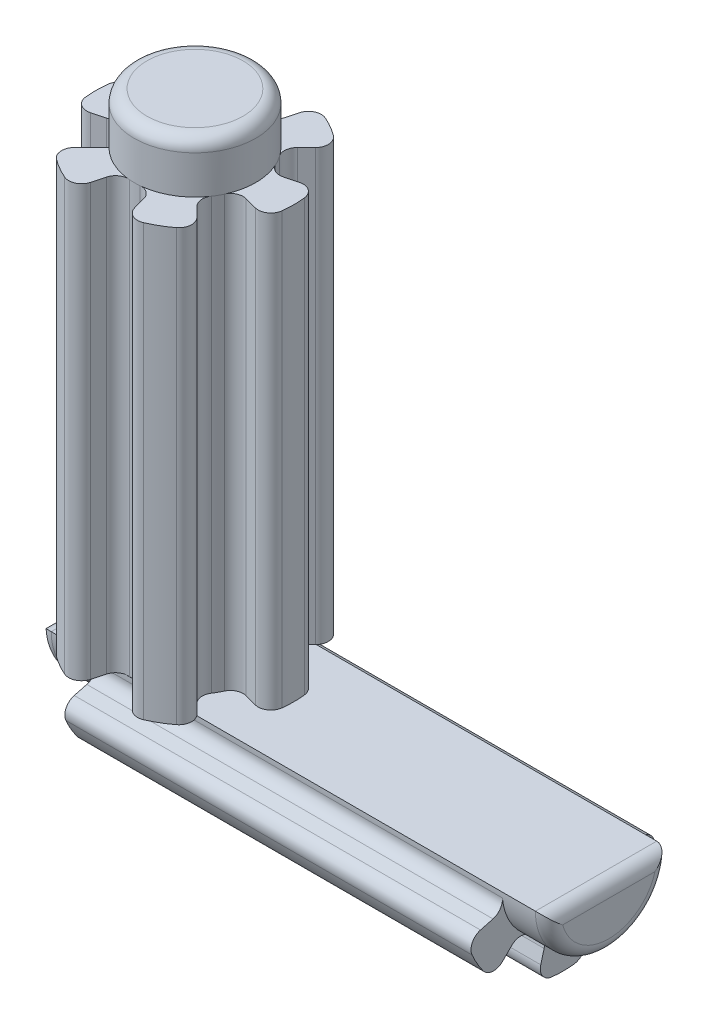
from build123d import *

# Parameters (mm, degrees)
BOSS_EXTRUDE1_DEPTH  = 16.85
SKETCH2_R            = 2.3799999999999994
BOSS_EXTRUDE2_DEPTH  = 2
BOSS_EXTRUDE9_START  = 2.3
BOSS_EXTRUDE9_DEPTH  = 19.95
BOSS_EXTRUDE10_START = 0.5
BOSS_EXTRUDE10_DEPTH = 15.9
FILLET2_3_DEPTH      = 16.85
FILLET2_START        = -1.5
FILLET2_4_DEPTH      = 15.9
FILLET2_5_DEPTH      = 16.85
FILLET2_START_2      = -3
FILLET2_6_DEPTH      = 6
FILLET2_7_DEPTH      = 15.9
FILLET3_R            = 0.5


with BuildPart() as part:
    # Sketch1 → Boss-Extrude1 (new body)
    with BuildSketch(Plane(origin=(0, 0, 0), x_dir=(1, 0, 0), z_dir=(0, 1, 0))):
        with BuildLine():
            Line((-2.7400387770978836, 2.74003877709786), (-1.679378605318062, 1.6793786053180386))
            ThreePointArc((-1.679378605318062, 1.6793786053180386), (-2.056810333988042, 1.1874999999999993), (-2.2940738374365335, 0.6146952321185013))
            Line((-2.2940738374365335, 0.6146952321185011), (-3.7429625768701356, 1.0029237997722829))
            ThreePointArc((-3.742962576870136, 1.0029237997722822), (-3.875, 1.424e-14), (-3.7429625768701427, -1.0029237997722564))
            Line((-3.742962576870142, -1.002923799772257), (-2.2940738374365406, -0.6146952321184749))
            ThreePointArc((-2.2940738374365406, -0.614695232118475), (-2.0568103339880466, -1.1874999999999907), (-1.6793786053180566, -1.6793786053180437))
            Line((-1.6793786053180566, -1.6793786053180435), (-2.740038777097876, -2.740038777097867))
            ThreePointArc((-2.740038777097877, -2.7400387770978663), (-1.9375000000000047, -3.355848439664697), (-1.0029237997722709, -3.7429625768701387))
            Line((-1.0029237997722698, -3.7429625768701387), (-0.6146952321184938, -2.2940738374365353))
            ThreePointArc((-0.6146952321184939, -2.2940738374365357), (-2.66e-15, -2.3750000000000004), (0.614695232118489, -2.2940738374365375))
            Line((0.6146952321184889, -2.294073837436537), (1.0029237997722713, -3.742962576870139))
            ThreePointArc((1.0029237997722693, -3.742962576870139), (1.9607957049122844, -3.34229041281537), (2.777890980129203, -2.7016562887452613))
            Line((2.7778909801292047, -2.7016562887452595), (1.7174212075554607, -1.6404540212510508))
            ThreePointArc((1.7174212075554605, -1.6404540212510508), (2.0702822023505663, -1.1638542016208417), (2.294073837436537, -0.6146952321184882))
            Line((2.294073837436537, -0.6146952321184883), (3.742962576870139, -1.0029237997722702))
            ThreePointArc((3.7429625768701387, -1.002923799772271), (3.8418488378235147, -0.5057889948527037), (3.875, -9.5e-16))
            ThreePointArc((3.875, 0), (3.8418488378235156, 0.5057889948526962), (3.7429625768701413, 1.0029237997722609))
            Line((3.7429625768701413, 1.002923799772261), (2.2940738374365384, 0.6146952321184828))
            ThreePointArc((2.2940738374365384, 0.6146952321184829), (2.0568103339880426, 1.1874999999999978), (1.6793786053180506, 1.67937860531805))
            Line((1.6793786053180506, 1.6793786053180497), (2.740038777097872, 2.740038777097871))
            ThreePointArc((2.7400387770978725, 2.740038777097871), (1.937499999999998, 3.355848439664701), (1.0029237997722638, 3.7429625768701404))
            Line((1.0029237997722638, 3.7429625768701404), (0.6146952321184845, 2.294073837436538))
            ThreePointArc((0.6146952321184845, 2.294073837436538), (-5.91e-15, 2.375), (-0.6146952321184961, 2.294073837436535))
            Line((-0.614695232118496, 2.294073837436535), (-1.0029237997722746, 3.7429625768701373))
            ThreePointArc((-1.0029237997722749, 3.742962576870138), (-1.9375000000000095, 3.355848439664694), (-2.7400387770978836, 2.7400387770978596))
        make_face()
    extrude(amount=BOSS_EXTRUDE1_DEPTH)

    # Sketch2 → Boss-Extrude2 (add)
    with BuildSketch(Plane(origin=(0, 16.85, 0), x_dir=(1, 0, 0), z_dir=(0, 1, 0))):
        with Locations(Location((0, 0, 0), (0, 0, 75))):
            Circle(SKETCH2_R)
    extrude(amount=BOSS_EXTRUDE2_DEPTH)

    # Sketch10 → Boss-Extrude9 (add)
    with BuildSketch(Plane(origin=(13.899999999999999, 0, 0), x_dir=(0, 0, -1), z_dir=(1, 0, 0)).offset(BOSS_EXTRUDE9_START)):
        with BuildLine():
            Line((2.375, 0), (-2.375, 0))
            ThreePointArc((-2.375, 0), (-2.3546815457628005, -0.30999970652261516), (-2.2940738374365415, -0.6146952321184724))
            ThreePointArc((-2.294073837436541, -0.6146952321184722), (-2.0568103339880484, -1.1874999999999882), (-1.679378605318059, -1.6793786053180417))
            ThreePointArc((-1.6793786053180593, -1.6793786053180415), (-1.1875000000000056, -2.0568103339880377), (-0.614695232118488, -2.294073837436537))
            ThreePointArc((-0.6146952321184879, -2.294073837436537), (8e-16, -2.375), (0.6146952321184889, -2.2940738374365366))
            ThreePointArc((0.6146952321184891, -2.2940738374365366), (1.1874999999999993, -2.0568103339880426), (1.6793786053180475, -1.679378605318053))
            ThreePointArc((1.679378605318047, -1.6793786053180533), (2.0568103339880404, -1.1875000000000027), (2.2940738374365366, -0.6146952321184884))
            ThreePointArc((2.294073837436536, -0.6146952321184882), (2.3546815457627996, -0.30999970652262326), (2.374999999999999, 1.5e-16))
        make_face()
    extrude(amount=-BOSS_EXTRUDE9_DEPTH)

    # Sketch10<3> → Boss-Extrude10 (add)
    with BuildSketch(Plane(origin=(13.899999999999999, 0, 0), x_dir=(0, 0, -1), z_dir=(1, 0, 0)).offset(BOSS_EXTRUDE10_START)):
        with BuildLine():
            Line((3.742962576870139, -1.0029237997722704), (2.2940738374365366, -0.6146952321184883))
            ThreePointArc((2.2940738374365366, -0.6146952321184884), (2.0568103339880404, -1.1875000000000027), (1.679378605318047, -1.6793786053180533))
            Line((1.6793786053180473, -1.6793786053180535), (2.740038777097866, -2.740038777097877))
            ThreePointArc((2.740038777097866, -2.7400387770978774), (3.3558484396646966, -1.937500000000004), (3.7429625768701396, -1.0029237997722706))
        make_face()
        with BuildLine():
            ThreePointArc((0.6146952321184889, -2.2940738374365366), (8e-16, -2.375), (-0.6146952321184879, -2.294073837436537))
            Line((-0.6146952321184881, -2.294073837436537), (-1.00292379977227, -3.7429625768701387))
            ThreePointArc((-1.0029237997722702, -3.7429625768701396), (9.4e-16, -3.874999999999999), (1.0029237997722722, -3.7429625768701387))
            Line((1.0029237997722715, -3.7429625768701382), (0.614695232118489, -2.2940738374365366))
        make_face()
        with BuildLine():
            ThreePointArc((-1.679378605318059, -1.6793786053180417), (-2.0568103339880484, -1.1874999999999882), (-2.294073837436541, -0.6146952321184722))
            Line((-2.294073837436541, -0.6146952321184723), (-3.7429625768701458, -1.002923799772244))
            ThreePointArc((-3.7429625768701453, -1.002923799772244), (-3.3558484396647104, -1.937499999999981), (-2.7400387770978853, -2.740038777097858))
            Line((-2.740038777097886, -2.740038777097858), (-1.6793786053180595, -1.6793786053180415))
        make_face()
    extrude(amount=-BOSS_EXTRUDE10_DEPTH)

    # Fillet2: read off the stored shape, not the designer's step
    # Fillet2 outline → Fillet2 (revolve, cut)
    with BuildSketch(Plane.XY):
        with BuildLine():
            ThreePointArc((1.88, 18.85), (2.233553391, 18.703553391), (2.38, 18.35))
            Line((2.38, 18.35), (2.38, 18.85))
            Line((2.38, 18.85), (1.88, 18.85))
        make_face()
    revolve(axis=Axis((0, 0, 0), (0, 1, 0)), mode=Mode.SUBTRACT)

    # Fillet2 2 outline → Fillet2 2 (revolve, cut)
    with BuildSketch(Plane.YX):
        with BuildLine():
            ThreePointArc((1.875, 16.2), (2.228553391, 16.053553391), (2.375, 15.7))
            Line((2.375, 15.7), (2.375, 16.2))
            Line((2.375, 16.2), (1.875, 16.2))
        make_face()
    revolve(axis=Axis((0, 0, 0), (1, 0, 0)), mode=Mode.SUBTRACT)

    # Fillet2 3 outline → Fillet2 3 (add)
    with BuildSketch(Plane(origin=(0, 0, 0), x_dir=(1, 0, 0), z_dir=(0, 1, 0))):
        with BuildLine():
            Line((-0.614695232, -2.294073837), (-0.732765352, -2.734717524))
            ThreePointArc((-0.732765352, -2.734717524), (-0.536645734, -2.454589596), (-0.206358537, -2.366017995))
            ThreePointArc((-0.206358537, -2.366017995), (-0.412099883, -2.338973853), (-0.614695232, -2.294073837))
        make_face()
        with BuildLine():
            ThreePointArc((0.614695232, -2.294073837), (0.412099883, -2.338973853), (0.206358537, -2.366017995))
            ThreePointArc((0.206358537, -2.366017995), (0.536645734, -2.454589596), (0.732765352, -2.734717524))
            Line((0.732765352, -2.734717524), (0.614695232, -2.294073837))
        make_face()
        with BuildLine():
            ThreePointArc((-2.734717524, -0.732765352), (-2.394059812, -0.762545959), (-2.152210958, -1.004297263))
            ThreePointArc((-2.152210958, -1.004297263), (-2.231660717, -0.81259796), (-2.294073837, -0.614695232))
            Line((-2.294073837, -0.614695232), (-2.734717524, -0.732765352))
        make_face()
        with BuildLine():
            Line((1.717421208, -1.640454021), (2.033046995, -1.95629782))
            ThreePointArc((2.033046995, -1.95629782), (1.889064583, -1.65120563), (1.971640266, -1.324107119))
            ThreePointArc((1.971640266, -1.324107119), (1.851300213, -1.487720579), (1.717421208, -1.640454021))
        make_face()
        with BuildLine():
            ThreePointArc((-2.152210958, 1.004297263), (-2.394059812, 0.762545959), (-2.734717524, 0.732765352))
            Line((-2.734717524, 0.732765352), (-2.294073837, 0.614695232))
            ThreePointArc((-2.294073837, 0.614695232), (-2.231660717, 0.81259796), (-2.152210958, 1.004297263))
        make_face()
        with BuildLine():
            ThreePointArc((2.294073837, -0.614695232), (2.231660717, -0.812597959), (2.152210958, -1.004297263))
            ThreePointArc((2.152210958, -1.004297263), (2.394059812, -0.762545959), (2.734717524, -0.732765352))
            Line((2.734717524, -0.732765352), (2.294073837, -0.614695232))
        make_face()
        with BuildLine():
            ThreePointArc((-2.001952172, 2.001952172), (-1.857414079, 1.692043636), (-1.945852421, 1.361720733))
            ThreePointArc((-1.945852421, 1.361720733), (-1.819560834, 1.526375894), (-1.679378605, 1.679378605))
            Line((-1.679378605, 1.679378605), (-2.001952172, 2.001952172))
        make_face()
        with BuildLine():
            Line((2.294073837, 0.614695232), (2.734717524, 0.732765352))
            ThreePointArc((2.734717524, 0.732765352), (2.394059812, 0.762545959), (2.152210958, 1.004297263))
            ThreePointArc((2.152210958, 1.004297263), (2.231660717, 0.81259796), (2.294073837, 0.614695232))
        make_face()
        with BuildLine():
            ThreePointArc((-0.206358537, 2.366017995), (-0.536645734, 2.454589596), (-0.732765352, 2.734717524))
            Line((-0.732765352, 2.734717524), (-0.614695232, 2.294073837))
            ThreePointArc((-0.614695232, 2.294073837), (-0.412099883, 2.338973853), (-0.206358537, 2.366017995))
        make_face()
        with BuildLine():
            ThreePointArc((1.679378605, 1.679378605), (1.819560834, 1.526375894), (1.945852421, 1.361720733))
            ThreePointArc((1.945852421, 1.361720733), (1.857414079, 1.692043636), (2.001952172, 2.001952172))
            Line((2.001952172, 2.001952172), (1.679378605, 1.679378605))
        make_face()
        with BuildLine():
            ThreePointArc((0.732765352, 2.734717524), (0.536645734, 2.454589596), (0.206358537, 2.366017995))
            ThreePointArc((0.206358537, 2.366017995), (0.412099883, 2.338973853), (0.614695232, 2.294073837))
            Line((0.614695232, 2.294073837), (0.732765352, 2.734717524))
        make_face()
    extrude(amount=FILLET2_3_DEPTH)

    # Fillet2 4 outline → Fillet2 4 (add)
    with BuildSketch(Plane.YZ.offset(FILLET2_START)):
        with BuildLine():
            ThreePointArc((-2.001952172, 2.001952172), (-1.857414079, 1.692043636), (-1.945852421, 1.361720733))
            ThreePointArc((-1.945852421, 1.361720733), (-1.819560834, 1.526375894), (-1.679378605, 1.679378605))
            Line((-1.679378605, 1.679378605), (-2.001952172, 2.001952172))
        make_face()
        with BuildLine():
            ThreePointArc((-2.734717524, -0.732765352), (-2.394059812, -0.762545959), (-2.152210958, -1.004297263))
            ThreePointArc((-2.152210958, -1.004297263), (-2.231660717, -0.81259796), (-2.294073837, -0.614695232))
            Line((-2.294073837, -0.614695232), (-2.734717524, -0.732765352))
        make_face()
        with BuildLine():
            ThreePointArc((-0.732765352, -2.734717524), (-0.536645734, -2.454589596), (-0.206358537, -2.366017995))
            ThreePointArc((-0.206358537, -2.366017995), (-0.412099883, -2.338973853), (-0.614695232, -2.294073837))
            Line((-0.614695232, -2.294073837), (-0.732765352, -2.734717524))
        make_face()
        with BuildLine():
            Line((-2.001952172, -2.001952172), (-1.679378605, -1.679378605))
            ThreePointArc((-1.679378605, -1.679378605), (-1.819560834, -1.526375894), (-1.945852421, -1.361720733))
            ThreePointArc((-1.945852421, -1.361720733), (-1.857414079, -1.692043636), (-2.001952172, -2.001952172))
        make_face()
        with BuildLine():
            Line((-2.734717524, 0.732765352), (-2.294073837, 0.614695232))
            ThreePointArc((-2.294073837, 0.614695232), (-2.231660717, 0.81259796), (-2.152210958, 1.004297263))
            ThreePointArc((-2.152210958, 1.004297263), (-2.394059812, 0.762545959), (-2.734717524, 0.732765352))
        make_face()
        with BuildLine():
            Line((-0.732765352, 2.734717524), (-0.614695232, 2.294073837))
            ThreePointArc((-0.614695232, 2.294073837), (-0.412099883, 2.338973853), (-0.206358537, 2.366017995))
            ThreePointArc((-0.206358537, 2.366017995), (-0.536645734, 2.454589596), (-0.732765352, 2.734717524))
        make_face()
    extrude(amount=FILLET2_4_DEPTH)

    # Fillet2 5 outline → Fillet2 5 (cut)
    with BuildSketch(Plane(origin=(0, 0, 0), x_dir=(1, 0, 0), z_dir=(0, 1, 0))):
        with BuildLine():
            Line((-1.0029238, -3.742962577), (-0.863875204, -3.224026153))
            ThreePointArc((-0.863875204, -3.224026153), (-1.129692616, -3.545002943), (-1.54636969, -3.553078353))
            ThreePointArc((-1.54636969, -3.553078353), (-1.278177738, -3.658126115), (-1.0029238, -3.742962577))
        make_face()
        with BuildLine():
            ThreePointArc((-2.740038777, -2.740038777), (-2.528941277, -2.935997449), (-2.30387127, -3.115734612))
            ThreePointArc((-2.30387127, -3.115734612), (-2.505216298, -2.750843976), (-2.360150949, -2.360150949))
            Line((-2.360150949, -2.360150949), (-2.740038777, -2.740038777))
        make_face()
        with BuildLine():
            ThreePointArc((1.54636969, -3.553078353), (1.129692616, -3.545002943), (0.863875204, -3.224026153))
            Line((0.863875204, -3.224026153), (1.0029238, -3.742962577))
            ThreePointArc((1.0029238, -3.742962577), (1.278177738, -3.658126115), (1.54636969, -3.553078353))
        make_face()
        with BuildLine():
            Line((-3.742962577, -1.0029238), (-3.224026153, -0.863875204))
            ThreePointArc((-3.224026153, -0.863875204), (-3.634908913, -0.794158968), (-3.85024096, -0.437343741))
            ThreePointArc((-3.85024096, -0.437343741), (-3.807119014, -0.722128666), (-3.742962577, -1.0029238))
        make_face()
        with BuildLine():
            ThreePointArc((2.403932779, -2.327439785), (2.549154607, -2.714060306), (2.353999176, -3.078037179))
            ThreePointArc((2.353999176, -3.078037179), (2.572836914, -2.897608533), (2.77789098, -2.701656289))
            Line((2.77789098, -2.701656289), (2.403932779, -2.327439785))
        make_face()
        with BuildLine():
            ThreePointArc((-3.742962577, 1.0029238), (-3.807119014, 0.722128666), (-3.85024096, 0.437343741))
            ThreePointArc((-3.85024096, 0.437343741), (-3.634908913, 0.794158968), (-3.224026153, 0.863875204))
            Line((-3.224026153, 0.863875204), (-3.742962577, 1.0029238))
        make_face()
        with BuildLine():
            ThreePointArc((3.85024096, -0.437343741), (3.634908913, -0.794158968), (3.224026153, -0.863875204))
            Line((3.224026153, -0.863875204), (3.742962577, -1.0029238))
            ThreePointArc((3.742962577, -1.0029238), (3.807119014, -0.722128666), (3.85024096, -0.437343741))
        make_face()
        with BuildLine():
            Line((-2.740038777, 2.740038777), (-2.360150949, 2.360150949))
            ThreePointArc((-2.360150949, 2.360150949), (-2.505216298, 2.750843976), (-2.30387127, 3.115734612))
            ThreePointArc((-2.30387127, 3.115734612), (-2.528941277, 2.935997449), (-2.740038777, 2.740038777))
        make_face()
        with BuildLine():
            ThreePointArc((3.224026153, 0.863875204), (3.634908913, 0.794158968), (3.85024096, 0.437343741))
            ThreePointArc((3.85024096, 0.437343741), (3.807119014, 0.722128666), (3.742962577, 1.0029238))
            Line((3.742962577, 1.0029238), (3.224026153, 0.863875204))
        make_face()
        with BuildLine():
            ThreePointArc((-1.0029238, 3.742962577), (-1.278177738, 3.658126115), (-1.54636969, 3.553078353))
            ThreePointArc((-1.54636969, 3.553078353), (-1.129692616, 3.545002943), (-0.863875204, 3.224026153))
            Line((-0.863875204, 3.224026153), (-1.0029238, 3.742962577))
        make_face()
        with BuildLine():
            ThreePointArc((2.30387127, 3.115734612), (2.505216298, 2.750843976), (2.360150949, 2.360150949))
            Line((2.360150949, 2.360150949), (2.740038777, 2.740038777))
            ThreePointArc((2.740038777, 2.740038777), (2.528941277, 2.935997449), (2.30387127, 3.115734612))
        make_face()
        with BuildLine():
            Line((1.0029238, 3.742962577), (0.863875204, 3.224026153))
            ThreePointArc((0.863875204, 3.224026153), (1.129692616, 3.545002943), (1.54636969, 3.553078353))
            ThreePointArc((1.54636969, 3.553078353), (1.278177738, 3.658126115), (1.0029238, 3.742962577))
        make_face()
    extrude(amount=FILLET2_5_DEPTH, mode=Mode.SUBTRACT)

    # Fillet2 6 outline → Fillet2 6 (cut)
    with BuildSketch(Plane.XY.offset(FILLET2_START_2)):
        with BuildLine():
            ThreePointArc((15.7, 0), (16.053553391, -0.146446609), (16.2, -0.5))
            Line((16.2, -0.5), (16.2, 0))
            Line((16.2, 0), (15.7, 0))
        make_face()
    extrude(amount=FILLET2_6_DEPTH, mode=Mode.SUBTRACT)

    # Fillet2 7 outline → Fillet2 7 (cut)
    with BuildSketch(Plane.YZ.offset(FILLET2_START)):
        with BuildLine():
            Line((-1.0029238, -3.742962577), (-0.863875204, -3.224026153))
            ThreePointArc((-0.863875204, -3.224026153), (-1.129692616, -3.545002943), (-1.54636969, -3.553078353))
            ThreePointArc((-1.54636969, -3.553078353), (-1.278177738, -3.658126115), (-1.0029238, -3.742962577))
        make_face()
        with BuildLine():
            ThreePointArc((-2.740038777, -2.740038777), (-2.528941277, -2.935997449), (-2.30387127, -3.115734612))
            ThreePointArc((-2.30387127, -3.115734612), (-2.505216298, -2.750843976), (-2.360150949, -2.360150949))
            Line((-2.360150949, -2.360150949), (-2.740038777, -2.740038777))
        make_face()
        with BuildLine():
            Line((-3.742962577, -1.0029238), (-3.224026153, -0.863875204))
            ThreePointArc((-3.224026153, -0.863875204), (-3.634908913, -0.794158968), (-3.85024096, -0.437343741))
            ThreePointArc((-3.85024096, -0.437343741), (-3.807119014, -0.722128666), (-3.742962577, -1.0029238))
        make_face()
        with BuildLine():
            ThreePointArc((-3.742962577, 1.0029238), (-3.807119014, 0.722128666), (-3.85024096, 0.437343741))
            ThreePointArc((-3.85024096, 0.437343741), (-3.634908913, 0.794158968), (-3.224026153, 0.863875204))
            Line((-3.224026153, 0.863875204), (-3.742962577, 1.0029238))
        make_face()
        with BuildLine():
            Line((-2.740038777, 2.740038777), (-2.360150949, 2.360150949))
            ThreePointArc((-2.360150949, 2.360150949), (-2.505216298, 2.750843976), (-2.30387127, 3.115734612))
            ThreePointArc((-2.30387127, 3.115734612), (-2.528941277, 2.935997449), (-2.740038777, 2.740038777))
        make_face()
        with BuildLine():
            ThreePointArc((-1.0029238, 3.742962577), (-1.278177738, 3.658126115), (-1.54636969, 3.553078353))
            ThreePointArc((-1.54636969, 3.553078353), (-1.129692616, 3.545002943), (-0.863875204, 3.224026153))
            Line((-0.863875204, 3.224026153), (-1.0029238, 3.742962577))
        make_face()
    extrude(amount=FILLET2_7_DEPTH, mode=Mode.SUBTRACT)

    # Fillet3
    fillet3_edges = [part.edges().sort_by_distance(p)[0] for p in [
        (-3.7500000000000284, 0, 1.5302196801220762),
        (-3.75, -2.375000000000048, -5.294e-14),
    ]]
    fillet(fillet3_edges, radius=FILLET3_R)


solid = part.part
